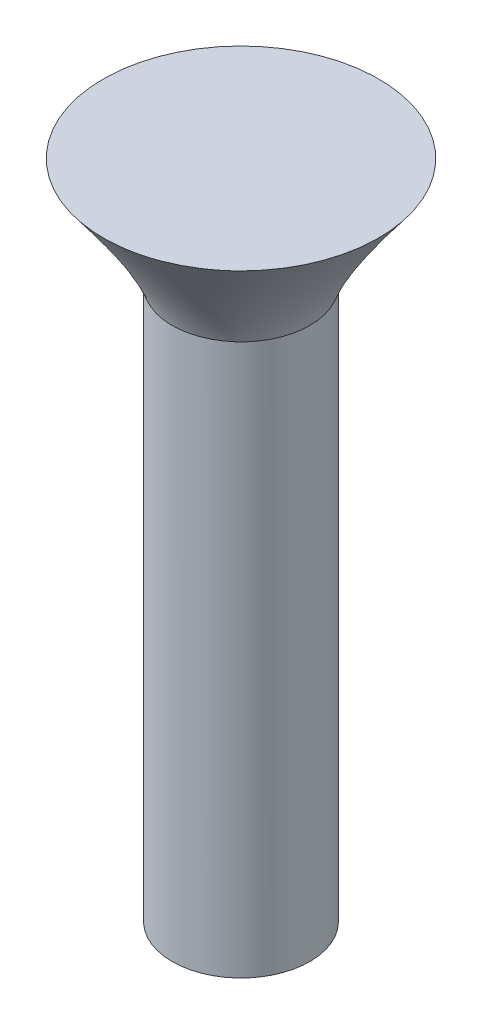
from build123d import *

# Parameters (mm, degrees)
SKETCH1_R           = 2.5
BOSS_EXTRUDE1_DEPTH = 20


with BuildPart() as part:
    # Sketch1 → Boss-Extrude1 (new body)
    with BuildSketch(Plane(origin=(0, 0, 0), x_dir=(1, 0, 0), z_dir=(0, 1, 0))):
        with Locations(Location((0, 0, 0), (0, 0, 270))):
            Circle(SKETCH1_R)
    extrude(amount=BOSS_EXTRUDE1_DEPTH)

    # Loft1: read off the stored shape, not the designer's step
    # Loft1: loft between two sections, ruled curve by curve
    loft1_from = [
        Edge.make_bspline([(-2.278508192, 20, -1.028785897), (-4.336079985, 20, 3.528230487), (0.220936399, 20, 5.58580228), (2.278508192, 20, 1.028785897), (4.336079985, 20, -3.528230487), (-0.220936399, 20, -5.58580228), (-2.278508192, 20, -1.028785897)], [0, 0, 0, 0, 0.5, 0.5, 0.5, 1, 1, 1, 1], 3, [1, 0.333333333, 0.333333333, 1, 0.333333333, 0.333333333, 1]),
    ]
    loft1_to = [
        Edge.make_bspline([(-2.253141331, 24.000000128, -4.463558462), (-11.180258255, 24.000000128, 0.042724199), (-6.673975593, 24.000000128, 8.969841123), (2.253141331, 24.000000128, 4.463558462), (11.180258255, 24.000000128, -0.042724199), (6.673975593, 24.000000128, -8.969841123), (-2.253141331, 24.000000128, -4.463558462)], [0, 0, 0, 0, 0.5, 0.5, 0.5, 1, 1, 1, 1], 3, [1, 0.333333333, 0.333333333, 1, 0.333333333, 0.333333333, 1]),
    ]
    loft1 = Solid(Shell([*[Face.make_surface_from_curves(loft1_from[k], loft1_to[k]) for k in range(1)], Face(Wire(loft1_from)), Face(Wire(loft1_to))]))
    add(loft1)


solid = part.part
